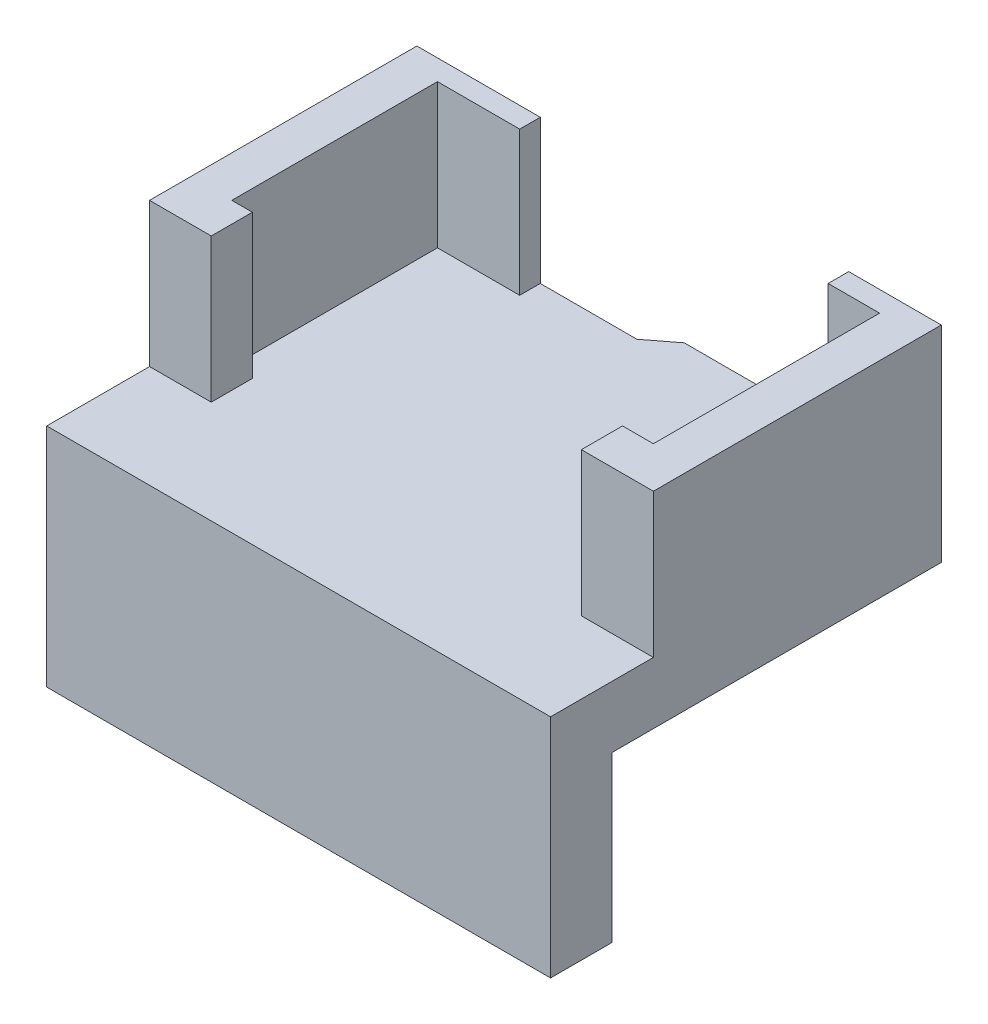
from build123d import *

# Parameters (mm, degrees)
BOSS_EXTRUDE1_DEPTH   = 7
BOSS_EXTRUDE1_2_DEPTH = 7
BOSS_EXTRUDE2_DEPTH   = 2
SKETCH4_W             = 14
SKETCH4_H             = 9
BOSS_EXTRUDE3_DEPTH   = 0.5
SKETCH5_W             = 11
SKETCH5_H             = 7
CUT_EXTRUDE1_DEPTH    = 0.5
SKETCH6_W             = 24.5
SKETCH6_H             = 2
BOSS_EXTRUDE4_DEPTH   = 5
BOSS_EXTRUDE6_DEPTH   = 1
SKETCH9_W             = 24.5
SKETCH9_H             = 3
BOSS_EXTRUDE7_DEPTH   = 8


with BuildPart() as part:
    # Sketch1 → Boss-Extrude1 (new body)
    with BuildSketch(Plane(origin=(0, 0, 0), x_dir=(1, 0, 0), z_dir=(0, 1, 0))):
        Polygon((-38.972010623, -19.234572985), (-37.972010623, -19.234572985), (-37.972010623, -21.234572985), (-40.972010623, -21.234572985), (-40.972010623, -8.234572985), (-34.972010623, -8.234572985), (-34.972010623, -9.234572985), (-38.972010623, -9.234572985), align=None)
    extrude(amount=BOSS_EXTRUDE1_DEPTH)



with BuildPart() as body_2:
    # Sketch1 → Boss-Extrude1 2 (new body)
    with BuildSketch(Plane(origin=(0, 0, 0), x_dir=(1, 0, 0), z_dir=(0, 1, 0))):
        Polygon((-18.972010623, -19.234572985), (-18.972010623, -8.234572985), (-20.972010623, -8.234572985), (-20.972010623, -7.234572985), (-16.972010623, -7.234572985), (-16.972010623, -21.234572985), (-19.972010623, -21.234572985), (-19.972010623, -19.234572985), align=None)
    extrude(amount=BOSS_EXTRUDE1_2_DEPTH)


with BuildPart() as part_1:
    add(part.part)

    add(body_2.part)  # Boss-Extrude2 merges body 2
    # Sketch2 → Boss-Extrude2 (add)
    with BuildSketch(Plane.XZ):
        Polygon((-40.972010623, 21.234572985), (-16.972010623, 21.234572985), (-16.972010623, 7.234572985), (-28.972010623, 7.234572985), (-30.273567276, 8.234572985), (-40.972010623, 8.234572985), align=None)
    extrude(amount=BOSS_EXTRUDE2_DEPTH)

    # Sketch4 → Boss-Extrude3 (add)
    with BuildSketch(Plane(origin=(-16.972010623, 0, 0), x_dir=(0, 0, -1), z_dir=(1, 0, 0))):
        with Locations((-14.234572985, 2.5)):
            Rectangle(SKETCH4_W, SKETCH4_H)
    extrude(amount=BOSS_EXTRUDE3_DEPTH)

    # Sketch5 → Cut-Extrude1 (cut)
    with BuildSketch(Plane.ZY.offset(18.972010623)):
        with Locations((13.734572985, 3.5)):
            Rectangle(SKETCH5_W, SKETCH5_H)
    extrude(amount=-CUT_EXTRUDE1_DEPTH, mode=Mode.SUBTRACT)

    # Sketch6 → Boss-Extrude4 (add)
    with BuildSketch(Plane.XY.offset(21.234572985)):
        with Locations((-28.722010623, -1)):
            Rectangle(SKETCH6_W, SKETCH6_H)
    extrude(amount=BOSS_EXTRUDE4_DEPTH)

    # Sketch8 → Boss-Extrude6 (add)
    with BuildSketch(Plane.XZ.offset(2)):
        Polygon((-40.972010623, 26.234572985), (-40.972010623, 8.234572985), (-30.273567276, 8.234572985), (-28.972010623, 7.234572985), (-16.472010623, 7.234572985), (-16.472010623, 26.234572985), align=None)
    extrude(amount=BOSS_EXTRUDE6_DEPTH)

    # Sketch9 → Boss-Extrude7 (add)
    with BuildSketch(Plane(origin=(0, -3, 0), x_dir=(-1, 0, 0), z_dir=(0, -1, 0))):
        with Locations((28.722010623, -24.734572985)):
            Rectangle(SKETCH9_W, SKETCH9_H)
    extrude(amount=BOSS_EXTRUDE7_DEPTH)


solid = part_1.part
